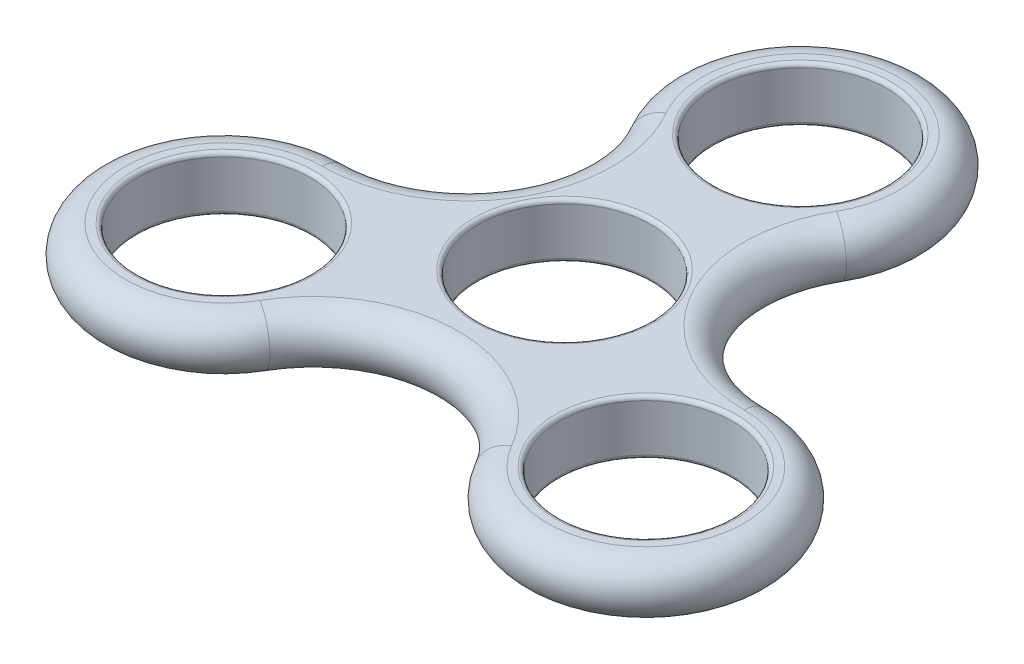
from build123d import *

# Parameters (mm, degrees)
SKETCH1_R           = 11
BOSS_EXTRUDE1_DEPTH = 3.5
FILLET1_R           = 3.5
FILLET2_R           = 0.5


with BuildPart() as part:
    # Sketch1 → Boss-Extrude1 (new, symmetric)
    with BuildSketch(Plane(origin=(0, 0, 0), x_dir=(1, 0, 0), z_dir=(0, 1, 0))):
        with BuildLine():
            ThreePointArc((-26.846787517, -0.5), (-40.703193978, -24.5), (-12.990381057, -24.5))
            ThreePointArc((-12.990381057, -24.5), (0, -17), (12.990381057, -24.5))
            ThreePointArc((12.990381057, -24.5), (40.703193978, -24.5), (26.846787517, -0.5))
            ThreePointArc((26.846787517, -0.5), (13.856406461, 7), (13.856406461, 22))
            ThreePointArc((13.856406461, 22), (0, 46), (-13.856406461, 22))
            ThreePointArc((-13.856406461, 22), (-13.856406461, 7), (-26.846787517, -0.5))
        make_face()
        with Locations(Location((-26.846787517, -16.5, 0), (0, 0, 270))):
            Circle(SKETCH1_R, mode=Mode.SUBTRACT)
        with Locations(Location((0, 0, 0), (0, 0, 270))):
            Circle(SKETCH1_R, mode=Mode.SUBTRACT)
        with Locations(Location((0, 30, 0), (0, 0, 270))):
            Circle(SKETCH1_R, mode=Mode.SUBTRACT)
        with Locations(Location((26.846787517, -16.5, 0), (0, 0, 270))):
            Circle(SKETCH1_R, mode=Mode.SUBTRACT)
    extrude(amount=BOSS_EXTRUDE1_DEPTH, both=True)

    # Fillet1
    fillet1_edges = [part.edges().sort_by_distance(p)[0] for p in [
        (-13.856406461, -3.5, -7),
        (-40.703193978, 3.5, 24.5),
        (0, -3.5, -46),
        (13.856406461, -3.5, -7),
        (40.703193978, -3.5, 24.5),
        (0, -3.5, 17),
    ]]
    fillet(fillet1_edges, radius=FILLET1_R - 0.0001)  # a hair under: the kernel refuses the full size

    # Fillet2
    fillet2_edges = [part.edges().sort_by_distance(p)[0] for p in [
        (26.846787517, -3.5, 5.5),
        (0, -3.5, -41),
        (0, -3.5, -11),
        (-26.846787517, -3.5, 5.5),
        (0, 3.5, -11),
        (0, 3.5, -41),
        (26.846787517, 3.5, 5.5),
        (-26.846787517, 3.5, 5.5),
    ]]
    fillet(fillet2_edges, radius=FILLET2_R)


solid = part.part
